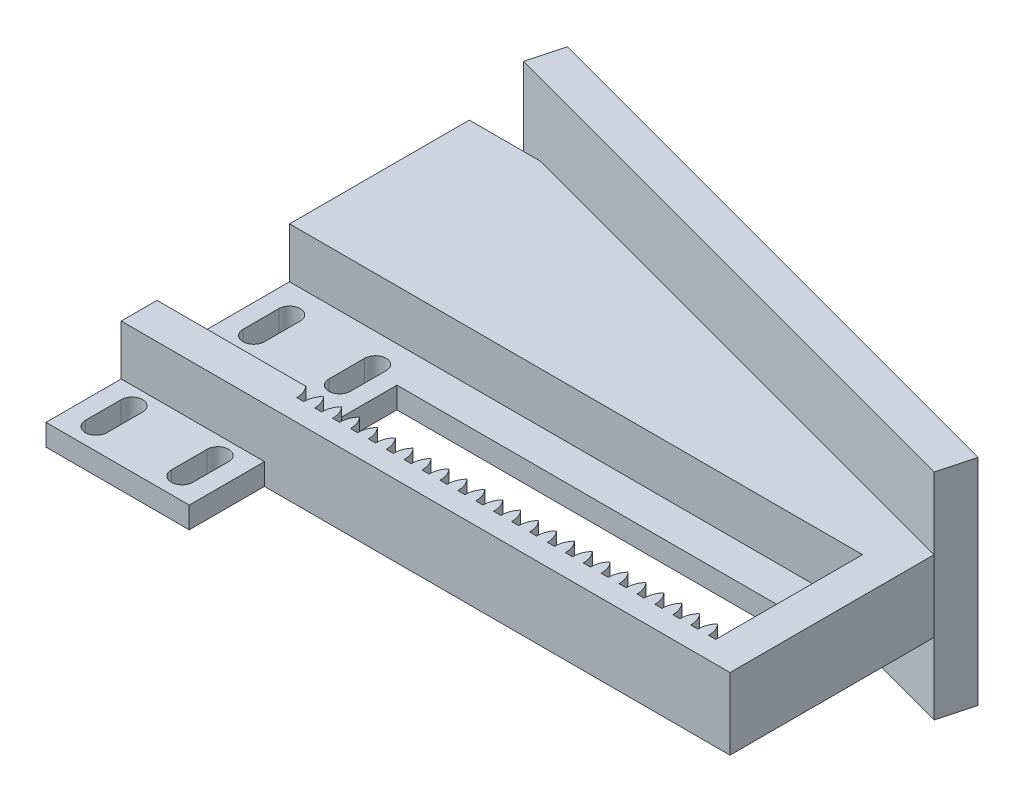
from build123d import *

# Parameters (mm, degrees)
SKETCH1_W            = 80
SKETCH1_H            = 10
BOSS_EXTRUDE1_DEPTH  = 5
CUT_EXTRUDE1_DEPTH   = 7
LPATTERN1_START      = -5
LPATTERN1_DEPTH      = 10
SKETCH3_W            = 20
SKETCH3_H            = 34
BOSS_EXTRUDE2_DEPTH  = 3
CUT_EXTRUDE2_DEPTH   = 3
LPATTERN2_COUNT      = 2
LPATTERN2_PITCH      = 12
LPATTERN2_COUNT_DIR2 = 2
LPATTERN2_PITCH_DIR2 = 22
SKETCH5_W            = 20
SKETCH5_H            = 3
CUT_EXTRUDE3_DEPTH   = 5
SKETCH6_W            = 80
SKETCH6_H            = 10
BOSS_EXTRUDE3_DEPTH  = 10
SKETCH7_W            = 28.5
SKETCH7_H            = 10
BOSS_EXTRUDE4_DEPTH  = 5
BOSS_EXTRUDE5_DEPTH  = 10
SKETCH9_W            = 81.068419054
SKETCH9_H            = 30
BOSS_EXTRUDE6_DEPTH  = 5
CUT_EXTRUDE4_START   = -3
CUT_EXTRUDE4_DEPTH   = 10
LPATTERN3_COUNT      = 2
LPATTERN3_PITCH      = 12
SKETCH12_W           = 20
SKETCH12_H           = 5
CUT_EXTRUDE5_DEPTH   = 7
SKETCH13_W           = 60
SKETCH13_H           = 5
CUT_EXTRUDE6_DEPTH   = 7


# Read off the part's stored shape, not the designer's step: LPattern1
with BuildPart() as part:
    # Sketch1 → Boss-Extrude1 (new body)
    with BuildSketch(Plane.XY):
        Rectangle(SKETCH1_W, SKETCH1_H)
    extrude(amount=BOSS_EXTRUDE1_DEPTH)

    # Sketch2 → Cut-Extrude1 (cut, symmetric)
    with BuildSketch(Plane(origin=(0, 0, 0), x_dir=(1, 0, 0), z_dir=(0, 1, 0))):
        with BuildLine():
            Line((-18.5, -2), (-17.5, -2))
            add(Edge.make_bspline(
                [(-17.5, -2), (-17.518065012, -0.855520601), (-16.77373265, 0)],
                knots=[0, 0, 0, 1, 1, 1], degree=2))
            Line((-16.77373265, 0), (-19.22626735, 0))
            add(Edge.make_bspline(
                [(-18.5, -2), (-18.481934988, -0.855520601), (-19.22626735, 0)],
                knots=[0, 0, 0, 1, 1, 1], degree=2))
        make_face()
    extrude(amount=CUT_EXTRUDE1_DEPTH, both=True, mode=Mode.SUBTRACT)

    # LPattern1 outline → LPattern1 (cut)
    with BuildSketch(Plane(origin=(0, 0, 0), x_dir=(1, 0, 0), z_dir=(0, 1, 0)).offset(LPATTERN1_START)):
        with BuildLine():
            Line((40, 0), (38.27373265, 0))
            add(Edge.make_bspline(
                [(38.27373265, 0), (39.018065012, -0.855520601), (39, -2)],
                knots=[0, 0, 0, 1, 1, 1], degree=2))
            Line((39, -2), (40, -2))
            Line((40, -2), (40, 0))
        make_face()
        with BuildLine():
            add(Edge.make_bspline(
                [(-15, -2), (-15.018065012, -0.855520601), (-14.27373265, 0)],
                knots=[0, 0, 0, 1, 1, 1], degree=2))
            Line((-14.27373265, 0), (-16.72626735, 0))
            add(Edge.make_bspline(
                [(-16.72626735, 0), (-15.981934988, -0.855520601), (-16, -2)],
                knots=[0, 0, 0, 1, 1, 1], degree=2))
            Line((-16, -2), (-15, -2))
        make_face()
        with BuildLine():
            add(Edge.make_bspline(
                [(-12.5, -2), (-12.518065012, -0.855520601), (-11.77373265, 0)],
                knots=[0, 0, 0, 1, 1, 1], degree=2))
            Line((-11.77373265, 0), (-14.22626735, 0))
            add(Edge.make_bspline(
                [(-14.22626735, 0), (-13.481934988, -0.855520601), (-13.5, -2)],
                knots=[0, 0, 0, 1, 1, 1], degree=2))
            Line((-13.5, -2), (-12.5, -2))
        make_face()
        with BuildLine():
            add(Edge.make_bspline(
                [(-10, -2), (-10.018065012, -0.855520601), (-9.27373265, 0)],
                knots=[0, 0, 0, 1, 1, 1], degree=2))
            Line((-9.27373265, 0), (-11.72626735, 0))
            add(Edge.make_bspline(
                [(-11.72626735, 0), (-10.981934988, -0.855520601), (-11, -2)],
                knots=[0, 0, 0, 1, 1, 1], degree=2))
            Line((-11, -2), (-10, -2))
        make_face()
        with BuildLine():
            add(Edge.make_bspline(
                [(-7.5, -2), (-7.518065012, -0.855520601), (-6.77373265, 0)],
                knots=[0, 0, 0, 1, 1, 1], degree=2))
            Line((-6.77373265, 0), (-9.22626735, 0))
            add(Edge.make_bspline(
                [(-9.22626735, 0), (-8.481934988, -0.855520601), (-8.5, -2)],
                knots=[0, 0, 0, 1, 1, 1], degree=2))
            Line((-8.5, -2), (-7.5, -2))
        make_face()
        with BuildLine():
            add(Edge.make_bspline(
                [(-5, -2), (-5.018065012, -0.855520601), (-4.27373265, 0)],
                knots=[0, 0, 0, 1, 1, 1], degree=2))
            Line((-4.27373265, 0), (-6.72626735, 0))
            add(Edge.make_bspline(
                [(-6.72626735, 0), (-5.981934988, -0.855520601), (-6, -2)],
                knots=[0, 0, 0, 1, 1, 1], degree=2))
            Line((-6, -2), (-5, -2))
        make_face()
        with BuildLine():
            add(Edge.make_bspline(
                [(-2.5, -2), (-2.518065012, -0.855520601), (-1.77373265, 0)],
                knots=[0, 0, 0, 1, 1, 1], degree=2))
            Line((-1.77373265, 0), (-4.22626735, 0))
            add(Edge.make_bspline(
                [(-4.22626735, 0), (-3.481934988, -0.855520601), (-3.5, -2)],
                knots=[0, 0, 0, 1, 1, 1], degree=2))
            Line((-3.5, -2), (-2.5, -2))
        make_face()
        with BuildLine():
            add(Edge.make_bspline(
                [(0, -2), (-0.018065012, -0.855520601), (0.72626735, 0)],
                knots=[0, 0, 0, 1, 1, 1], degree=2))
            Line((0.72626735, 0), (-1.72626735, 0))
            add(Edge.make_bspline(
                [(-1.72626735, 0), (-0.981934988, -0.855520601), (-1, -2)],
                knots=[0, 0, 0, 1, 1, 1], degree=2))
            Line((-1, -2), (0, -2))
        make_face()
        with BuildLine():
            add(Edge.make_bspline(
                [(2.5, -2), (2.481934988, -0.855520601), (3.22626735, 0)],
                knots=[0, 0, 0, 1, 1, 1], degree=2))
            Line((3.22626735, 0), (0.77373265, 0))
            add(Edge.make_bspline(
                [(0.77373265, 0), (1.518065012, -0.855520601), (1.5, -2)],
                knots=[0, 0, 0, 1, 1, 1], degree=2))
            Line((1.5, -2), (2.5, -2))
        make_face()
        with BuildLine():
            add(Edge.make_bspline(
                [(5, -2), (4.981934988, -0.855520601), (5.72626735, 0)],
                knots=[0, 0, 0, 1, 1, 1], degree=2))
            Line((5.72626735, 0), (3.27373265, 0))
            add(Edge.make_bspline(
                [(3.27373265, 0), (4.018065012, -0.855520601), (4, -2)],
                knots=[0, 0, 0, 1, 1, 1], degree=2))
            Line((4, -2), (5, -2))
        make_face()
        with BuildLine():
            add(Edge.make_bspline(
                [(7.5, -2), (7.481934988, -0.855520601), (8.22626735, 0)],
                knots=[0, 0, 0, 1, 1, 1], degree=2))
            Line((8.22626735, 0), (5.77373265, 0))
            add(Edge.make_bspline(
                [(5.77373265, 0), (6.518065012, -0.855520601), (6.5, -2)],
                knots=[0, 0, 0, 1, 1, 1], degree=2))
            Line((6.5, -2), (7.5, -2))
        make_face()
        with BuildLine():
            add(Edge.make_bspline(
                [(10, -2), (9.981934988, -0.855520601), (10.72626735, 0)],
                knots=[0, 0, 0, 1, 1, 1], degree=2))
            Line((10.72626735, 0), (8.27373265, 0))
            add(Edge.make_bspline(
                [(8.27373265, 0), (9.018065012, -0.855520601), (9, -2)],
                knots=[0, 0, 0, 1, 1, 1], degree=2))
            Line((9, -2), (10, -2))
        make_face()
        with BuildLine():
            add(Edge.make_bspline(
                [(12.5, -2), (12.481934988, -0.855520601), (13.22626735, 0)],
                knots=[0, 0, 0, 1, 1, 1], degree=2))
            Line((13.22626735, 0), (10.77373265, 0))
            add(Edge.make_bspline(
                [(10.77373265, 0), (11.518065012, -0.855520601), (11.5, -2)],
                knots=[0, 0, 0, 1, 1, 1], degree=2))
            Line((11.5, -2), (12.5, -2))
        make_face()
        with BuildLine():
            add(Edge.make_bspline(
                [(15, -2), (14.981934988, -0.855520601), (15.72626735, 0)],
                knots=[0, 0, 0, 1, 1, 1], degree=2))
            Line((15.72626735, 0), (13.27373265, 0))
            add(Edge.make_bspline(
                [(13.27373265, 0), (14.018065012, -0.855520601), (14, -2)],
                knots=[0, 0, 0, 1, 1, 1], degree=2))
            Line((14, -2), (15, -2))
        make_face()
        with BuildLine():
            add(Edge.make_bspline(
                [(17.5, -2), (17.481934988, -0.855520601), (18.22626735, 0)],
                knots=[0, 0, 0, 1, 1, 1], degree=2))
            Line((18.22626735, 0), (15.77373265, 0))
            add(Edge.make_bspline(
                [(15.77373265, 0), (16.518065012, -0.855520601), (16.5, -2)],
                knots=[0, 0, 0, 1, 1, 1], degree=2))
            Line((16.5, -2), (17.5, -2))
        make_face()
        with BuildLine():
            add(Edge.make_bspline(
                [(20, -2), (19.981934988, -0.855520601), (20.72626735, 0)],
                knots=[0, 0, 0, 1, 1, 1], degree=2))
            Line((20.72626735, 0), (18.27373265, 0))
            add(Edge.make_bspline(
                [(18.27373265, 0), (19.018065012, -0.855520601), (19, -2)],
                knots=[0, 0, 0, 1, 1, 1], degree=2))
            Line((19, -2), (20, -2))
        make_face()
        with BuildLine():
            add(Edge.make_bspline(
                [(22.5, -2), (22.481934988, -0.855520601), (23.22626735, 0)],
                knots=[0, 0, 0, 1, 1, 1], degree=2))
            Line((23.22626735, 0), (20.77373265, 0))
            add(Edge.make_bspline(
                [(20.77373265, 0), (21.518065012, -0.855520601), (21.5, -2)],
                knots=[0, 0, 0, 1, 1, 1], degree=2))
            Line((21.5, -2), (22.5, -2))
        make_face()
        with BuildLine():
            add(Edge.make_bspline(
                [(25, -2), (24.981934988, -0.855520601), (25.72626735, 0)],
                knots=[0, 0, 0, 1, 1, 1], degree=2))
            Line((25.72626735, 0), (23.27373265, 0))
            add(Edge.make_bspline(
                [(23.27373265, 0), (24.018065012, -0.855520601), (24, -2)],
                knots=[0, 0, 0, 1, 1, 1], degree=2))
            Line((24, -2), (25, -2))
        make_face()
        with BuildLine():
            add(Edge.make_bspline(
                [(27.5, -2), (27.481934988, -0.855520601), (28.22626735, 0)],
                knots=[0, 0, 0, 1, 1, 1], degree=2))
            Line((28.22626735, 0), (25.77373265, 0))
            add(Edge.make_bspline(
                [(25.77373265, 0), (26.518065012, -0.855520601), (26.5, -2)],
                knots=[0, 0, 0, 1, 1, 1], degree=2))
            Line((26.5, -2), (27.5, -2))
        make_face()
        with BuildLine():
            add(Edge.make_bspline(
                [(30, -2), (29.981934988, -0.855520601), (30.72626735, 0)],
                knots=[0, 0, 0, 1, 1, 1], degree=2))
            Line((30.72626735, 0), (28.27373265, 0))
            add(Edge.make_bspline(
                [(28.27373265, 0), (29.018065012, -0.855520601), (29, -2)],
                knots=[0, 0, 0, 1, 1, 1], degree=2))
            Line((29, -2), (30, -2))
        make_face()
        with BuildLine():
            add(Edge.make_bspline(
                [(32.5, -2), (32.481934988, -0.855520601), (33.22626735, 0)],
                knots=[0, 0, 0, 1, 1, 1], degree=2))
            Line((33.22626735, 0), (30.77373265, 0))
            add(Edge.make_bspline(
                [(30.77373265, 0), (31.518065012, -0.855520601), (31.5, -2)],
                knots=[0, 0, 0, 1, 1, 1], degree=2))
            Line((31.5, -2), (32.5, -2))
        make_face()
        with BuildLine():
            add(Edge.make_bspline(
                [(35, -2), (34.981934988, -0.855520601), (35.72626735, 0)],
                knots=[0, 0, 0, 1, 1, 1], degree=2))
            Line((35.72626735, 0), (33.27373265, 0))
            add(Edge.make_bspline(
                [(33.27373265, 0), (34.018065012, -0.855520601), (34, -2)],
                knots=[0, 0, 0, 1, 1, 1], degree=2))
            Line((34, -2), (35, -2))
        make_face()
        with BuildLine():
            add(Edge.make_bspline(
                [(37.5, -2), (37.481934988, -0.855520601), (38.22626735, 0)],
                knots=[0, 0, 0, 1, 1, 1], degree=2))
            Line((38.22626735, 0), (35.77373265, 0))
            add(Edge.make_bspline(
                [(35.77373265, 0), (36.518065012, -0.855520601), (36.5, -2)],
                knots=[0, 0, 0, 1, 1, 1], degree=2))
            Line((36.5, -2), (37.5, -2))
        make_face()
    extrude(amount=LPATTERN1_DEPTH, mode=Mode.SUBTRACT)

    # Sketch3 → Boss-Extrude2 (add)
    with BuildSketch(Plane(origin=(0, -5, 5), x_dir=(-1, 0, 0), z_dir=(0, 1, 0))):
        with Locations((30, -1.5)):
            Rectangle(SKETCH3_W, SKETCH3_H)
    extrude(amount=BOSS_EXTRUDE2_DEPTH)

    # Sketch4 → Cut-Extrude2 (cut)
    with BuildSketch(Plane(origin=(0, -2, 0), x_dir=(1, 0, 0), z_dir=(0, 1, 0))):
        with BuildLine():
            Line((-37.5, -12.5), (-37.5, -7.5))
            ThreePointArc((-37.5, -7.5), (-36, -6), (-34.5, -7.5))
            Line((-34.5, -7.5), (-34.5, -12.5))
            ThreePointArc((-34.5, -12.5), (-36, -14), (-37.5, -12.5))
        make_face()
    cut_extrude2 = extrude(amount=-CUT_EXTRUDE2_DEPTH, mode=Mode.SUBTRACT)

    # LPattern2: Cut-Extrude2 2 × 2
    with Locations(*[(i * LPATTERN2_PITCH, 0, -j * LPATTERN2_PITCH_DIR2) for i in range(LPATTERN2_COUNT) for j in range(LPATTERN2_COUNT_DIR2) if (i, j) != (0, 0)]):
        add(cut_extrude2, mode=Mode.SUBTRACT)

    # Sketch5 → Cut-Extrude3 (cut)
    with BuildSketch(Plane.XY.offset(20.5)):
        with Locations((-30, -3.5)):
            Rectangle(SKETCH5_W, SKETCH5_H)
    extrude(amount=-CUT_EXTRUDE3_DEPTH, mode=Mode.SUBTRACT)

    # Sketch6 → Boss-Extrude3 (add)
    with BuildSketch(Plane(origin=(0, 0, -13.5), x_dir=(-1, 0, 0), z_dir=(0, 0, -1))):
        Rectangle(SKETCH6_W, SKETCH6_H)
    extrude(amount=BOSS_EXTRUDE3_DEPTH)

    # Sketch7 → Boss-Extrude4 (add)
    with BuildSketch(Plane(origin=(40, 0, 0), x_dir=(0, 0, -1), z_dir=(1, 0, 0))):
        with Locations((9.25, 0)):
            Rectangle(SKETCH7_W, SKETCH7_H)
    extrude(amount=BOSS_EXTRUDE4_DEPTH)

    # Sketch8 → Boss-Extrude5 (add)
    with BuildSketch(Plane(origin=(0, 5, 0), x_dir=(1, 0, 0), z_dir=(0, 1, 0))):
        Polygon((-40, 23.5), (45, 23.5), (-30, 43.596189432), (-40, 43.596189432), align=None)
    extrude(amount=-BOSS_EXTRUDE5_DEPTH)

    # Sketch9 → Boss-Extrude6 (add)
    with BuildSketch(Plane(origin=(8.889428415, 0, -33.175798494), x_dir=(-0.96592582628907, 0, -0.2588190451025143), z_dir=(0.2588190451025143, 0, -0.96592582628907))):
        with Locations((3.149794904, 0)):
            Rectangle(SKETCH9_W, SKETCH9_H)
    extrude(amount=BOSS_EXTRUDE6_DEPTH)

    # Sketch11 → Cut-Extrude4 (cut)
    with BuildSketch(Plane(origin=(0, -2, 0), x_dir=(1, 0, 0), z_dir=(0, 1, 0)).offset(CUT_EXTRUDE4_START)):
        with BuildLine():
            Line((-37.5, 9.5), (-37.5, 14.5))
            ThreePointArc((-37.5, 14.5), (-36, 16), (-34.5, 14.5))
            Line((-34.5, 14.5), (-34.5, 9.5))
            ThreePointArc((-34.5, 9.5), (-36, 8), (-37.5, 9.5))
        make_face()
    cut_extrude4 = extrude(amount=CUT_EXTRUDE4_DEPTH, mode=Mode.SUBTRACT)

    # LPattern3: Cut-Extrude4 ×2
    with Locations(*[(i * LPATTERN3_PITCH, 0, 0) for i in range(1, LPATTERN3_COUNT)]):
        add(cut_extrude4, mode=Mode.SUBTRACT)

    # Sketch12 → Cut-Extrude5 (cut)
    with BuildSketch(Plane(origin=(0, 5, 0), x_dir=(1, 0, 0), z_dir=(0, 1, 0))):
        with Locations((-30, 16)):
            Rectangle(SKETCH12_W, SKETCH12_H)
    extrude(amount=-CUT_EXTRUDE5_DEPTH, mode=Mode.SUBTRACT)

    # Sketch13 → Cut-Extrude6 (cut)
    with BuildSketch(Plane(origin=(0, 5, 0), x_dir=(1, 0, 0), z_dir=(0, 1, 0))):
        with Locations((10, 16)):
            Rectangle(SKETCH13_W, SKETCH13_H)
    extrude(amount=-CUT_EXTRUDE6_DEPTH, mode=Mode.SUBTRACT)


solid = part.part
